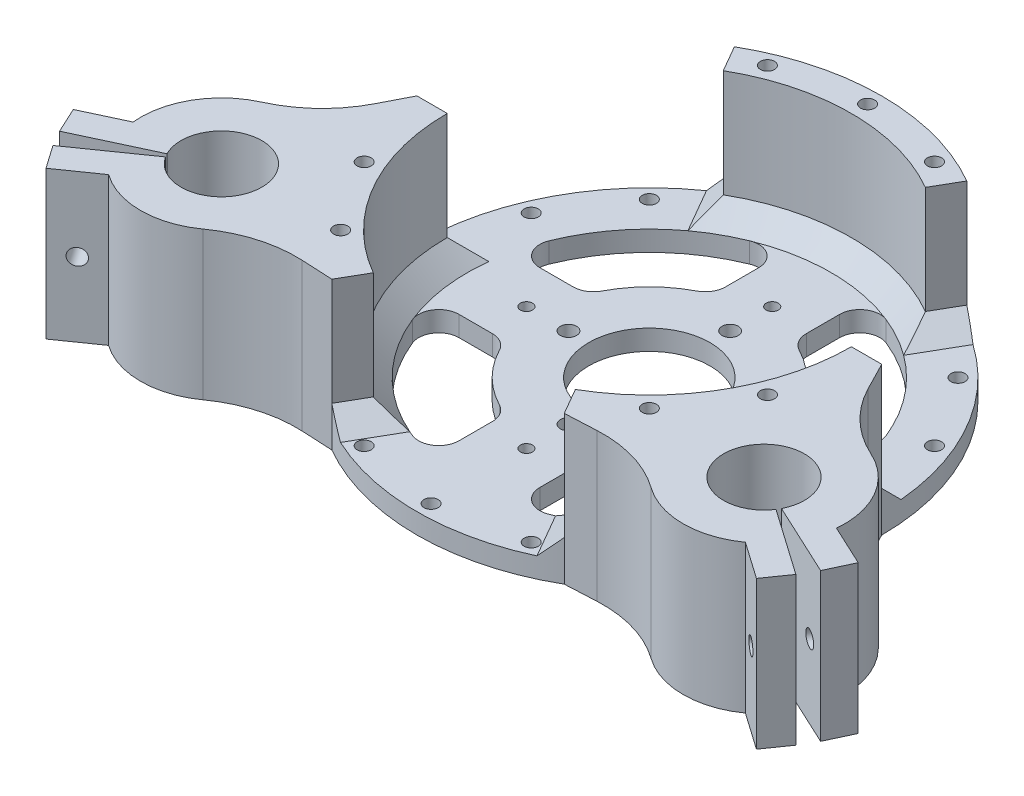
from build123d import *

# Parameters (mm, degrees)
SKETCH1_R            = 57.5
BOSS_EXTRUDE1_DEPTH  = 36.6
SKETCH2_R            = 50
CUT_EXTRUDE1_DEPTH   = 31.6
SKETCH3_R            = 2
SKETCH3_R_2          = 15
CUT_EXTRUDE2_DEPTH   = 31.8
SKETCH4_R            = 1.5
SKETCH4_R_2          = 1.75
CUT_EXTRUDE3_DEPTH   = 50
CUT_EXTRUDE4_START   = -31.6
CUT_EXTRUDE4_DEPTH   = 31.6
CIRPATTERN1_COUNT    = 3
FILLET2_R            = 5
CHAMFER1_SIZE        = 5
BOSS_EXTRUDE2_REACH  = 91.174
FILLET3_R            = 30
SKETCH7_R            = 2
CUT_EXTRUDE5_DEPTH   = 10
SKETCH8_R            = 2
CUT_EXTRUDE6_DEPTH   = 10
FILLET3_OF_MIRROR1_R = 30


with BuildPart() as part:
    # Sketch1 → Boss-Extrude1 (new body)
    with BuildSketch(Plane(origin=(0, 0, 0), x_dir=(1, 0, 0), z_dir=(0, 1, 0))):
        with Locations(Location((0, 0, 0), (0, 0, 270))):
            Circle(SKETCH1_R)
    extrude(amount=BOSS_EXTRUDE1_DEPTH)

    # Sketch2 → Cut-Extrude1 (cut)
    with BuildSketch(Plane(origin=(0, 36.6, 0), x_dir=(1, 0, 0), z_dir=(0, 1, 0))):
        with Locations(Location((0, 0, 0), (0, 0, 270))):
            Circle(SKETCH2_R)
    extrude(amount=-CUT_EXTRUDE1_DEPTH, mode=Mode.SUBTRACT)

    # Sketch3 → Cut-Extrude2 (cut)
    with BuildSketch(Plane.XZ):
        with BuildLine():
            Line((-10, 25.617376915), (-10, 43.874821937))
            ThreePointArc((-10, 43.874821937), (-31.819805153, 31.819805153), (-43.874821937, 10))
            Line((-43.874821937, 10), (-25.617376915, 10))
            ThreePointArc((-25.617376915, 10), (-19.445436483, 19.445436483), (-10, 25.617376915))
        make_face()
        with BuildLine():
            Line((25.617376915, 10), (43.874821937, 10))
            ThreePointArc((43.874821937, 10), (31.819805153, 31.819805153), (10, 43.874821937))
            Line((10, 43.874821937), (10, 25.617376915))
            ThreePointArc((10, 25.617376915), (19.445436483, 19.445436483), (25.617376915, 10))
        make_face()
        with BuildLine():
            ThreePointArc((10, -43.874821937), (31.819805153, -31.819805153), (43.874821937, -10))
            Line((43.874821937, -10), (25.617376915, -10))
            ThreePointArc((25.617376915, -10), (19.445436483, -19.445436483), (10, -25.617376915))
            Line((10, -25.617376915), (10, -43.874821937))
        make_face()
        with BuildLine():
            ThreePointArc((-43.874821937, -10), (-31.819805153, -31.819805153), (-10, -43.874821937))
            Line((-10, -43.874821937), (-10, -25.617376915))
            ThreePointArc((-10, -25.617376915), (-19.445436483, -19.445436483), (-25.617376915, -10))
            Line((-25.617376915, -10), (-43.874821937, -10))
        make_face()
        with Locations(Location((-20, 0, 0), (0, 0, 270))):
            Circle(SKETCH3_R)
        with Locations(Location((0, 0, 0), (0, 0, 270))):
            Circle(SKETCH3_R_2)
        with Locations(Location((0, 20, 0), (0, 0, 270))):
            Circle(SKETCH3_R)
        with Locations(Location((20, 0, 0), (0, 0, 270))):
            Circle(SKETCH3_R)
        with Locations(Location((0, -20, 0), (0, 0, 270))):
            Circle(SKETCH3_R)
    extrude(amount=-CUT_EXTRUDE2_DEPTH, mode=Mode.SUBTRACT)

    # Sketch4 → Cut-Extrude3 (cut)
    with BuildSketch(Plane.XZ):
        with Locations(Location((0, 30.405591591, 0), (0, 0, 270))):
            Circle(SKETCH4_R)
        with Locations(Location((30.405591591, 0, 0), (0, 0, 270))):
            Circle(SKETCH4_R)
        with Locations(Location((0, -30.405591591, 0), (0, 0, 270))):
            Circle(SKETCH4_R)
        with Locations(Location((-30.405591591, 0, 0), (0, 0, 270))):
            Circle(SKETCH4_R)
        with Locations(Location((0, 54, 0), (0, 0, 270))):
            Circle(SKETCH4_R_2)
        with Locations(Location((20.664905348, 49.889494756, 0), (0, 0, 270))):
            Circle(SKETCH4_R_2)
        with Locations(Location((38.183766184, 38.183766184, 0), (0, 0, 270))):
            Circle(SKETCH4_R_2)
        with Locations(Location((49.889494756, 20.664905348, 0), (0, 0, 270))):
            Circle(SKETCH4_R_2)
        with Locations(Location((49.889494756, -20.664905348, 0), (0, 0, 270))):
            Circle(SKETCH4_R_2)
        with Locations(Location((38.183766184, -38.183766184, 0), (0, 0, 270))):
            Circle(SKETCH4_R_2)
        with Locations(Location((20.664905348, -49.889494756, 0), (0, 0, 270))):
            Circle(SKETCH4_R_2)
        with Locations(Location((0, -54, 0), (0, 0, 270))):
            Circle(SKETCH4_R_2)
        with Locations(Location((-20.664905348, -49.889494756, 0), (0, 0, 270))):
            Circle(SKETCH4_R_2)
        with Locations(Location((-38.183766184, -38.183766184, 0), (0, 0, 270))):
            Circle(SKETCH4_R_2)
        with Locations(Location((-49.889494756, -20.664905348, 0), (0, 0, 270))):
            Circle(SKETCH4_R_2)
        with Locations(Location((-49.889494756, 20.664905348, 0), (0, 0, 270))):
            Circle(SKETCH4_R_2)
        with Locations(Location((-38.183766184, 38.183766184, 0), (0, 0, 270))):
            Circle(SKETCH4_R_2)
        with Locations(Location((-20.664905348, 49.889494756, 0), (0, 0, 270))):
            Circle(SKETCH4_R_2)
    extrude(amount=-CUT_EXTRUDE3_DEPTH, mode=Mode.SUBTRACT)

    # Sketch5 → Cut-Extrude4 (cut)
    with BuildSketch(Plane(origin=(0, 36.6, 0), x_dir=(1, 0, 0), z_dir=(0, 1, 0)).offset(CUT_EXTRUDE4_START)):
        with BuildLine():
            Line((0, 0), (-28.75, -49.796460718))
            ThreePointArc((-28.75, -49.796460718), (0, -57.5), (28.75, -49.796460718))
            Line((28.75, -49.796460718), (0, 0))
        make_face()
    cut_extrude4 = extrude(amount=CUT_EXTRUDE4_DEPTH, mode=Mode.SUBTRACT)

    # CirPattern1: Cut-Extrude4 ×3 about axis
    cirpattern1_axis = Axis((0, 0, 0), (0, 1, 0))
    for i in range(1, CIRPATTERN1_COUNT):
        add(cut_extrude4.rotate(cirpattern1_axis, i * 360 / CIRPATTERN1_COUNT), mode=Mode.SUBTRACT)

    # Fillet2
    fillet2_edges = [part.edges().sort_by_distance(p)[0] for p in [
        (43.874821937, 2.5, 10),
        (25.617376915, 2.5, 10),
        (10, 2.5, 25.617376915),
        (10, 2.5, 43.874821937),
        (10, 2.5, -43.874821937),
        (10, 2.5, -25.617376915),
        (25.617376915, 2.5, -10),
        (43.874821937, 2.5, -10),
        (-43.874821937, 2.5, -10),
        (-25.617376915, 2.5, -10),
        (-10, 2.5, -25.617376915),
        (-10, 2.5, -43.874821937),
        (-10, 2.5, 43.874821937),
        (-10, 2.5, 25.617376915),
        (-25.617376915, 2.5, 10),
        (-43.874821937, 2.5, 10),
    ]]
    fillet(fillet2_edges, radius=FILLET2_R)

    # Chamfer1
    chamfer1_edges = [part.edges().sort_by_distance(p)[0] for p in [
        (26.875, 5, 46.548865453),
        (-26.875, 5, 46.548865453),
        (-43.301270189, 5, 25),
        (-53.75, 5, 0),
        (-26.875, 5, -46.548865453),
        (0, 5, -50),
        (26.875, 5, -46.548865453),
        (53.75, 5, 0),
        (43.301270189, 5, 25),
    ]]
    chamfer(chamfer1_edges, length=CHAMFER1_SIZE - 0.0001)  # a hair under: the kernel refuses the full size

    # Boss-Extrude2: up to this face of the body (flat: up to its plane)
    boss_extrude2_end = Plane(part.part.faces().sort_by_distance((-32.969805153, 0, 32.969805153))[0])
    # Sketch6 → Boss-Extrude2 (add, up to the picked face)
    with BuildSketch(Plane(origin=(0, 36.6, 0), x_dir=(1, 0, 0), z_dir=(0, 1, 0)), mode=Mode.PRIVATE) as boss_extrude2_sk1:
        with BuildLine():
            ThreePointArc((75.516475651, -44.176627364), (58.456714755, -33.75), (76.016319376, -43.310872636))
            Line((76.016319376, -43.310872636), (94.142475117, -51.763237871))
            Line((94.142475117, -51.763237871), (97.100802949, -45.419083361))
            Line((97.100802949, -45.419083361), (87.01988076, -40.718272143))
            ThreePointArc((87.01988076, -40.718272143), (81.93866645, -25.321773067), (67.116968793, -18.75))
            Line((67.116968793, -18.75), (57.5, 0))
            ThreePointArc((57.5, 0), (49.796460718, -28.75), (28.75, -49.796460718))
            Line((28.75, -49.796460718), (49.796460718, -48.75))
            ThreePointArc((49.796460718, -48.75), (62.89863197, -58.300080165), (78.772998455, -55.002291301))
            Line((78.772998455, -55.002291301), (87.884481482, -61.382220401))
            Line((87.884481482, -61.382220401), (91.899516537, -55.648156091))
            Line((91.899516537, -55.648156091), (75.516475651, -44.176627364))
        make_face()
    boss_extrude2_tool1 = split(extrude(boss_extrude2_sk1.sketch, amount=-BOSS_EXTRUDE2_REACH, mode=Mode.PRIVATE), bisect_by=boss_extrude2_end, keep=Keep.BOTH, mode=Mode.PRIVATE)
    boss_extrude2 = boss_extrude2_tool1.solids().sort_by(Axis((50.592055, 36.6, 29.209337), (0, -1, 0)))[0]
    add(boss_extrude2)

    # Fillet3
    fillet3_edges = [part.edges().sort_by_distance(p)[0] for p in [
        (49.796460718, 18.3, 48.75),
        (67.116968793, 18.3, 18.75),
    ]]
    fillet(fillet3_edges, radius=FILLET3_R)

    # Sketch7 → Cut-Extrude5 (cut)
    with BuildSketch(Plane(origin=(-0.053713249, 0, 0.115188434), x_dir=(-0.9063077870366505, 0, -0.4226182617406986), z_dir=(0.4226182617406986, 0, -0.9063077870366505))):
        with Locations((-101.636614427, 18.3)):
            Circle(SKETCH7_R)
    cut_extrude5 = extrude(amount=-CUT_EXTRUDE5_DEPTH, mode=Mode.SUBTRACT)

    # Sketch8 → Cut-Extrude6 (cut)
    with BuildSketch(Plane(origin=(0.072899485, 0, -0.104111255), x_dir=(0.819152044288992, 0, 0.5735764363510458), z_dir=(-0.5735764363510458, 0, 0.819152044288992))):
        with Locations((101.636614427, 18.3)):
            Circle(SKETCH8_R)
    cut_extrude6 = extrude(amount=-CUT_EXTRUDE6_DEPTH, mode=Mode.SUBTRACT)

    # Mirror1: Boss-Extrude2, Cut-Extrude5, Cut-Extrude6 across plane
    add(boss_extrude2.mirror(Plane(origin=(0, 0, 0), x_dir=(0, 0, 1), z_dir=(1, 0, 0))))
    add(cut_extrude5.mirror(Plane(origin=(0, 0, 0), x_dir=(0, 0, 1), z_dir=(1, 0, 0))), mode=Mode.SUBTRACT)
    add(cut_extrude6.mirror(Plane(origin=(0, 0, 0), x_dir=(0, 0, 1), z_dir=(1, 0, 0))), mode=Mode.SUBTRACT)

    # Fillet3 of Mirror1
    fillet3_of_mirror1_edges = [part.edges().sort_by_distance(p)[0] for p in [
        (-49.796460718, 18.3, 48.75),
        (-67.116968793, 18.3, 18.75),
    ]]
    fillet(fillet3_of_mirror1_edges, radius=FILLET3_OF_MIRROR1_R)


solid = part.part
